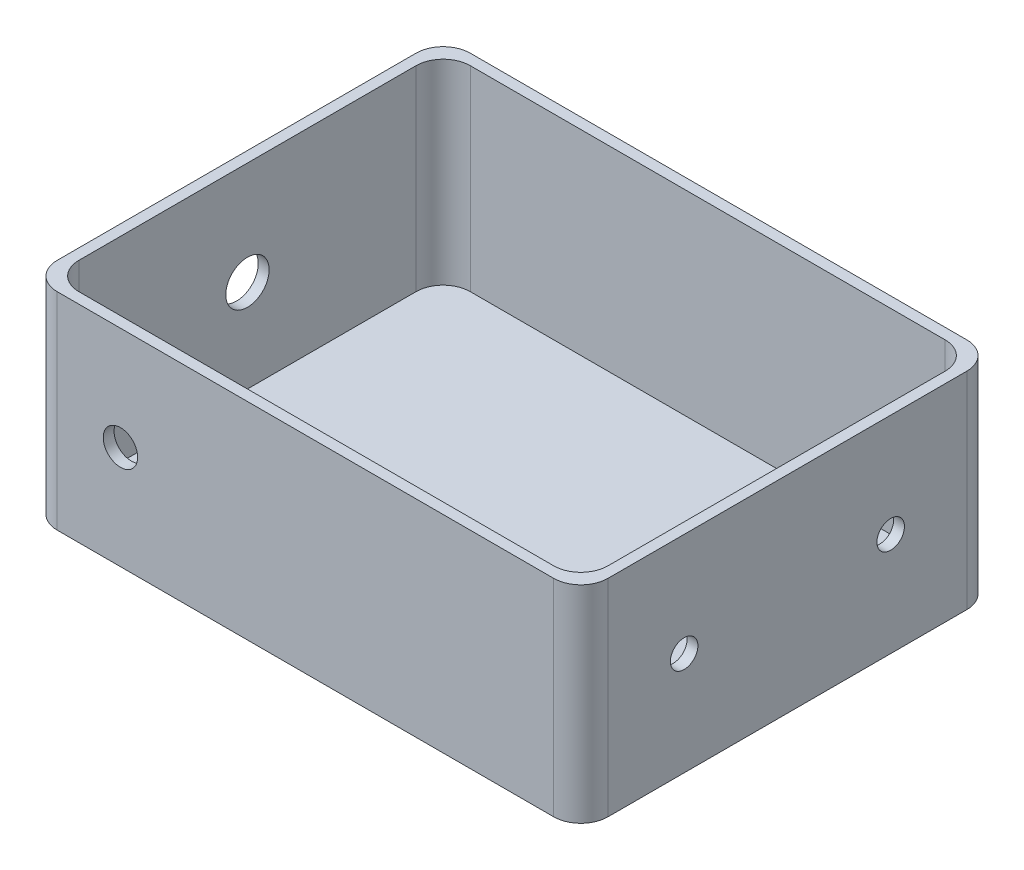
from build123d import *

# Parameters (mm, degrees)
SKETCH1_W           = 101.6
SKETCH1_H           = 76.2
BOSS_EXTRUDE1_DEPTH = 38.1
SKETCH3_W           = 97.6
SKETCH3_H           = 72.2
CUT_EXTRUDE1_DEPTH  = 36.1
SKETCH7_R           = 2.54
CUT_EXTRUDE2_DEPTH  = 2
SKETCH9_R           = 4
CUT_EXTRUDE3_DEPTH  = 2
SKETCH11_R          = 3.175
CUT_EXTRUDE4_DEPTH  = 2
FILLET1_R           = 5
FILLET2_R           = 5
CUT_EXTRUDE5_DEPTH  = 1


with BuildPart() as part:
    # Sketch1 → Boss-Extrude1 (new body)
    with BuildSketch(Plane(origin=(0, 0, 0), x_dir=(1, 0, 0), z_dir=(0, 1, 0))):
        Rectangle(SKETCH1_W, SKETCH1_H)
    extrude(amount=BOSS_EXTRUDE1_DEPTH)

    # Sketch3 → Cut-Extrude1 (cut)
    with BuildSketch(Plane(origin=(0, 38.1, 0), x_dir=(1, 0, 0), z_dir=(0, 1, 0))):
        Rectangle(SKETCH3_W, SKETCH3_H)
    extrude(amount=-CUT_EXTRUDE1_DEPTH, mode=Mode.SUBTRACT)

    # Sketch7 → Cut-Extrude2 (cut)
    with BuildSketch(Plane(origin=(50.8, 0, 0), x_dir=(0, 0, -1), z_dir=(1, 0, 0))):
        with Locations((-19.05, 19.05)):
            Circle(SKETCH7_R)
        with Locations((19.05, 19.05)):
            Circle(SKETCH7_R)
    extrude(amount=-CUT_EXTRUDE2_DEPTH, mode=Mode.SUBTRACT)

    # Sketch9 → Cut-Extrude3 (cut)
    with BuildSketch(Plane.ZY.offset(50.8)):
        with Locations((0, 19.05)):
            Circle(SKETCH9_R)
    extrude(amount=-CUT_EXTRUDE3_DEPTH, mode=Mode.SUBTRACT)

    # Sketch11 → Cut-Extrude4 (cut)
    with BuildSketch(Plane.XY.offset(38.1)):
        with Locations((-34.127797524, 19.05)):
            Circle(SKETCH11_R)
    extrude(amount=-CUT_EXTRUDE4_DEPTH, mode=Mode.SUBTRACT)

    # Fillet1
    fillet1_edges = [part.edges().sort_by_distance(p)[0] for p in [
        (-50.8, 19.05, 38.1),
        (-50.8, 19.05, -38.1),
        (50.8, 19.05, -38.1),
        (50.8, 19.05, 38.1),
    ]]
    fillet(fillet1_edges, radius=FILLET1_R)

    # Fillet2
    fillet2_edges = [part.edges().sort_by_distance(p)[0] for p in [
        (48.8, 20.05, -36.1),
        (48.8, 20.05, 36.1),
        (-48.8, 20.05, -36.1),
        (-48.8, 20.05, 36.1),
    ]]
    fillet(fillet2_edges, radius=FILLET2_R)

    # Sketch12 → Cut-Extrude5 (cut)
    # profile 1 of 2: a face of its own
    with BuildSketch(Plane.XZ):
        Polygon((-16.893847177, 6.052120704), (-32.260033074, 6.052120704), (-24.77410559, 22.334171986), (-24.386134837, 22.334171986), align=None)
        Polygon((-19.09446817, 7.476800191), (-24.576940125, 19.395770544), (-30.056231992, 7.476800191), align=None, mode=Mode.SUBTRACT)
    # profile 2 of 2: a face of its own
    with BuildSketch(Plane.XZ):
        Polygon((-6.564920895, 6.052120704), (-15.774456151, 6.052120704), (-11.338233194, 14.110464053), (-15.774456151, 21.927120704), (-6.768446536, 21.927120704), (-6.768446536, 20.298915576), (-13.255826343, 20.298915576), (-9.61780551, 13.887857884), (-13.144523258, 7.476800191), (-6.564920895, 7.476800191), align=None)
    extrude(amount=-CUT_EXTRUDE5_DEPTH, mode=Mode.SUBTRACT)


solid = part.part
